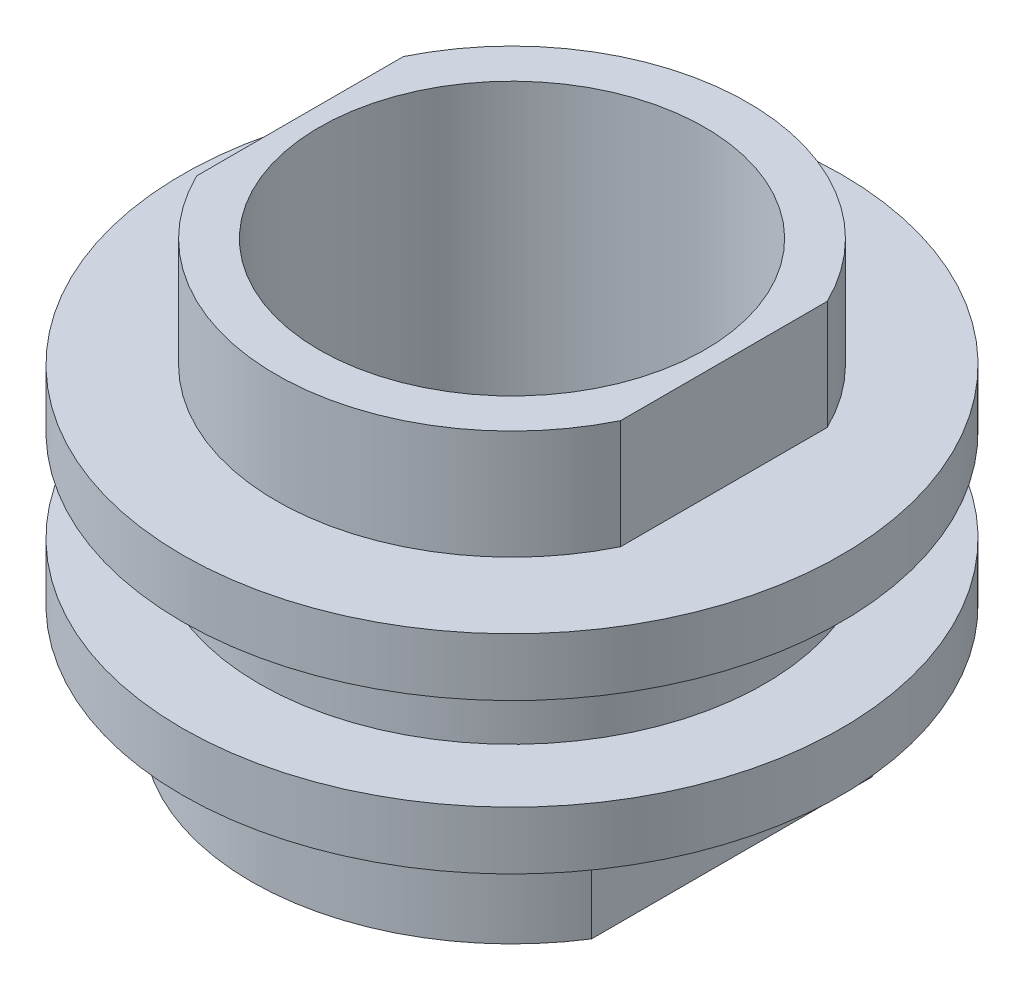
from build123d import *

# Parameters (mm, degrees)
SKETCH1_R           = 4.625
BOSS_EXTRUDE1_DEPTH = 0.845
SKETCH2_R           = 6.035
BOSS_EXTRUDE2_DEPTH = 1.06
BOSS_EXTRUDE3_START = 1.06
SKETCH3_R           = 6.035
BOSS_EXTRUDE3_DEPTH = 1.06
BOSS_EXTRUDE4_DEPTH = 2
BOSS_EXTRUDE5_DEPTH = 2
SKETCH6_R           = 3.5306
CUT_EXTRUDE1_DEPTH  = 12.568861223


with BuildPart() as part:
    # Sketch1 → Boss-Extrude1 (new, symmetric)
    with BuildSketch(Plane(origin=(0, 0, 0), x_dir=(1, 0, 0), z_dir=(0, 1, 0))):
        Circle(SKETCH1_R)
    extrude(amount=BOSS_EXTRUDE1_DEPTH, both=True)

    # Sketch2 → Boss-Extrude2 (add)
    with BuildSketch(Plane(origin=(0, 0.845, 0), x_dir=(1, 0, 0), z_dir=(0, 1, 0))):
        Circle(SKETCH2_R)
    extrude(amount=BOSS_EXTRUDE2_DEPTH)

    # Sketch3 → Boss-Extrude3 (add)
    with BuildSketch(Plane.XZ.offset(0.845).offset(BOSS_EXTRUDE3_START)):
        Circle(SKETCH3_R)
    extrude(amount=-BOSS_EXTRUDE3_DEPTH)

    # Sketch4 → Boss-Extrude4 (add)
    with BuildSketch(Plane(origin=(0, 1.905, 0), x_dir=(1, 0, 0), z_dir=(0, 1, 0))):
        with BuildLine():
            Line((-3.881348315, 1.892157303), (-3.881348315, 0))
            Line((-3.881348315, 0), (-3.881348315, -1.892157303))
            ThreePointArc((-3.881348315, -1.892157303), (0, -4.318), (3.881348315, -1.892157303))
            Line((3.881348315, -1.892157303), (3.881348315, 0))
            Line((3.881348315, 0), (3.881348315, 1.892157303))
            ThreePointArc((3.881348315, 1.892157303), (0, 4.318), (-3.881348315, 1.892157303))
        make_face()
    extrude(amount=BOSS_EXTRUDE4_DEPTH)

    # Sketch5 → Boss-Extrude5 (add)
    with BuildSketch(Plane.XZ.offset(1.905)):
        with BuildLine():
            Line((-4.024811429, 2.569713604), (-4.024811429, 0))
            Line((-4.024811429, 0), (-4.024811429, -2.569713604))
            ThreePointArc((-4.024811429, -2.569713604), (0, -4.7752), (4.024811429, -2.569713604))
            Line((4.024811429, -2.569713604), (4.024811429, 0))
            Line((4.024811429, 0), (4.024811429, 2.569713604))
            ThreePointArc((4.024811429, 2.569713604), (0, 4.7752), (-4.024811429, 2.569713604))
        make_face()
    extrude(amount=BOSS_EXTRUDE5_DEPTH)

    # Sketch6 → Cut-Extrude1 (cut, through all)
    with BuildSketch(Plane(origin=(0, 3.905, 0), x_dir=(1, 0, 0), z_dir=(0, 1, 0))):
        Circle(SKETCH6_R)
    extrude(amount=-CUT_EXTRUDE1_DEPTH, mode=Mode.SUBTRACT)


solid = part.part
